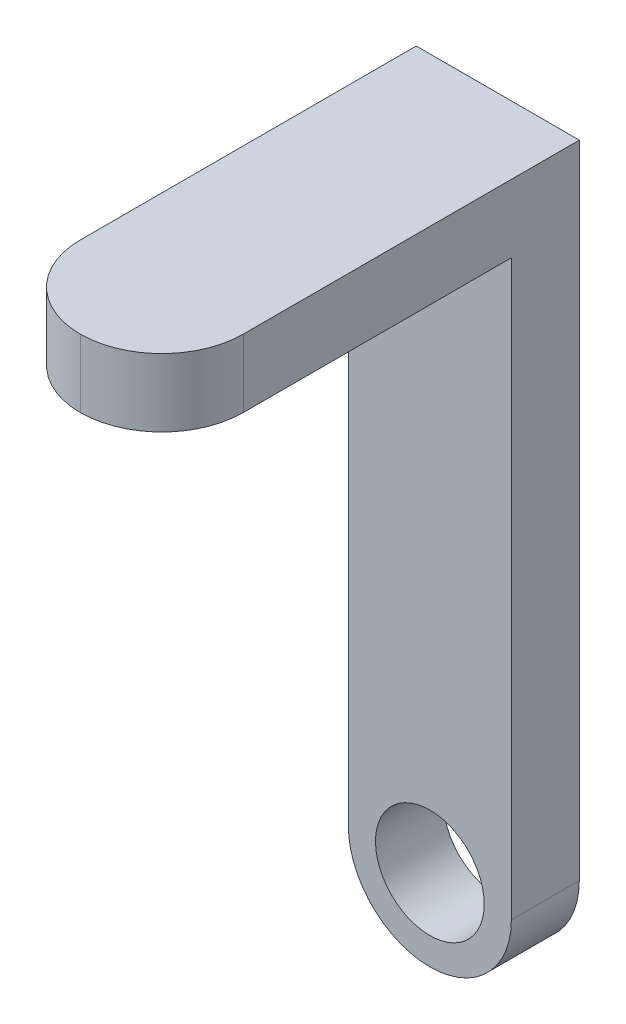
from build123d import *
from build123d.topology import SkipClean

# Parameters (mm, degrees)
SKETCH1_R           = 6
BOSS_EXTRUDE1_DEPTH = 5
BOSS_EXTRUDE2_START = -5
BOSS_EXTRUDE2_DEPTH = 5
CUT_EXTRUDE1_START  = -3
SKETCH3_R           = 4
CUT_EXTRUDE1_DEPTH  = 3
SKETCH4_W           = 12
SKETCH4_H           = 5
BOSS_EXTRUDE3_DEPTH = 25.73
FILLET1_R           = 6


with BuildPart() as part:
    # Sketch1 → Boss-Extrude1 (new body)
    with BuildSketch(Plane.XY):
        Circle(SKETCH1_R)
        with BuildLine():
            Line((-2.645751311, 3), (2.645751311, 3))
            ThreePointArc((2.645751311, 3), (0, -4), (-2.645751311, 3))
        make_face(mode=Mode.SUBTRACT)
    extrude(amount=BOSS_EXTRUDE1_DEPTH)

    # Sketch2 → Boss-Extrude2 (add)
    with BuildSketch(Plane.XY.offset(5).offset(BOSS_EXTRUDE2_START)):
        with BuildLine():
            Line((-6, 0), (-6, 47.2))
            Line((-6, 47.2), (6, 47.2))
            Line((6, 47.2), (6, 0))
            ThreePointArc((6, 0), (0, 6), (-6, 0))
        make_face()
    extrude(amount=BOSS_EXTRUDE2_DEPTH)

    # Sketch3 → Cut-Extrude1 (cut)
    with SkipClean():  # the faces are left unmerged after this step: merging them gives an invalid solid
        with BuildSketch(Plane.XY.offset(5).offset(CUT_EXTRUDE1_START)):
            with Locations(Location((0, 0, 0), (0, 0, 131.409622109))):
                Circle(SKETCH3_R)
        extrude(amount=CUT_EXTRUDE1_DEPTH, mode=Mode.SUBTRACT)

    # Sketch4 → Boss-Extrude3 (add)
    with SkipClean():  # the faces are left unmerged after this step: merging them gives an invalid solid
        with BuildSketch(Plane.XY.offset(5)):
            with Locations((0, 44.7)):
                Rectangle(SKETCH4_W, SKETCH4_H)
        extrude(amount=BOSS_EXTRUDE3_DEPTH)

    # Fillet1
    fillet1_edges = [part.edges().sort_by_distance(p)[0] for p in [
        (-6, 44.7, 30.73),
        (6, 44.7, 30.73),
    ]]
    fillet(fillet1_edges, radius=FILLET1_R - 0.0001)  # a hair under: the kernel refuses the full size


solid = part.part
